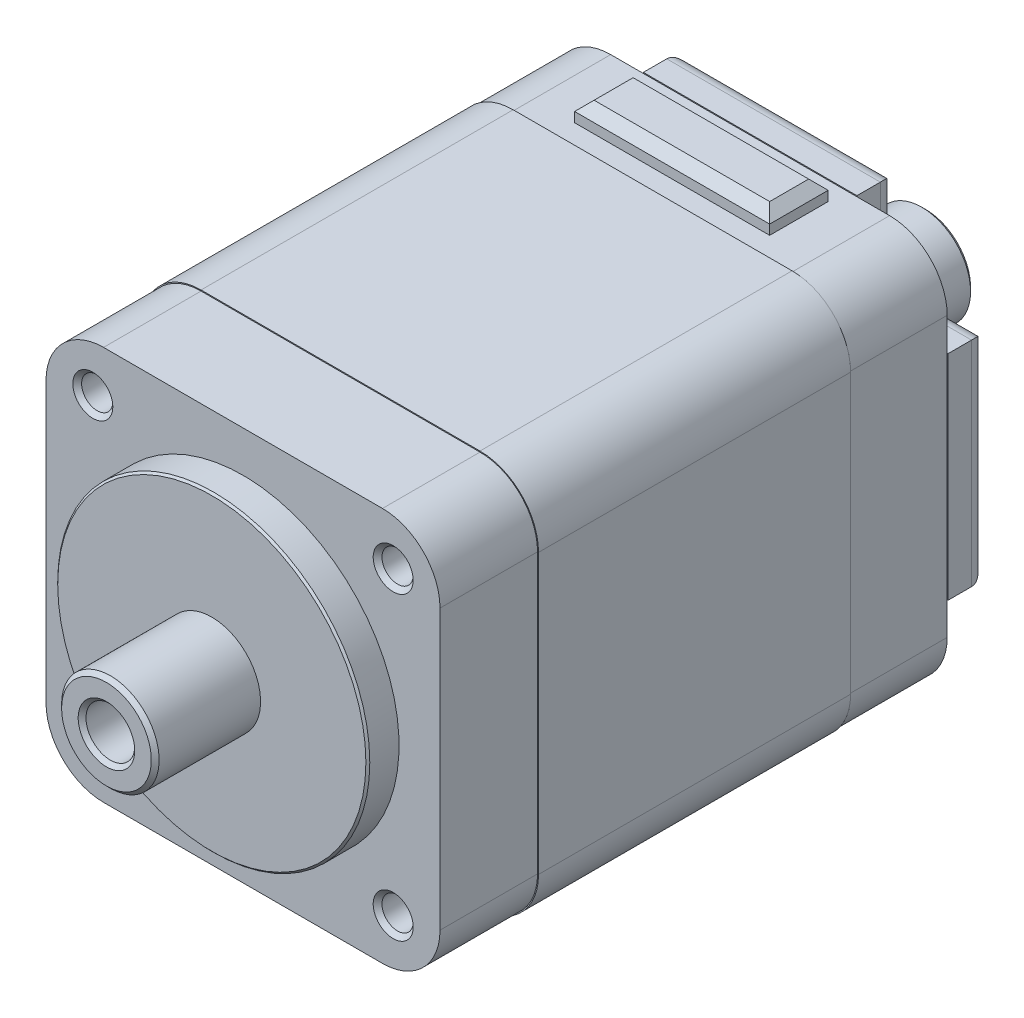
from build123d import *

# Parameters (mm, degrees)
SKETCH1_W               = 26
SKETCH1_H               = 20.3
BOSS_EXTRUDE1_DEPTH     = 10.15
SKETCH2_R               = 8
BOSS_EXTRUDE2_DEPTH     = 1.6
SKETCH3_R               = 2.5
BOSS_EXTRUDE3_DEPTH     = 5.4
CUT_EXTRUDE1_DEPTH      = 36.986733667
CUT_EXTRUDE1_DEPTH_BACK = 36.986733667
SKETCH4_R               = 1.25
CHAMFER1_SIZE           = 0.2
CHAMFER2_SIZE           = 0.2
SKETCH6_R               = 2.5
SKETCH6_R_2             = 1.25
BOSS_EXTRUDE4_DEPTH     = 9
SKETCH7_R               = 0.5
CUT_EXTRUDE2_DEPTH      = 2
CUT_EXTRUDE3_START      = -2
SKETCH8_R               = 0.5
CUT_EXTRUDE3_DEPTH      = 2
FILLET1_R               = 3
SKETCH10_R              = 2.6
BOSS_EXTRUDE5_DEPTH     = 2
FILLET2_R               = 0.8
SKETCH13_W              = 10
SKETCH13_H              = 3
BOSS_EXTRUDE7_DEPTH     = 1
CHAMFER3_SIZE           = 0.5
CUT_EXTRUDE5_DEPTH      = 5
CUT_EXTRUDE6_START      = -5
CUT_EXTRUDE6_DEPTH      = 5
CHAMFER4_SIZE           = 0.2
CHAMFER5_SIZE           = 0.1


# Read off the part's stored shape, not the designer's step: M2 Tapped Hole1
with BuildPart() as part:
    # Sketch1 → Boss-Extrude1 (new, symmetric)
    with BuildSketch(Plane(origin=(0, 0, 0), x_dir=(0, 0, -1), z_dir=(1, 0, 0))):
        Rectangle(SKETCH1_W, SKETCH1_H)
    extrude(amount=BOSS_EXTRUDE1_DEPTH, both=True)

    # Sketch2 → Boss-Extrude2 (add)
    with BuildSketch(Plane.XY.offset(13)):
        with Locations(Location((0, 0, 0), (0, 0, 180))):
            Circle(SKETCH2_R)
    extrude(amount=BOSS_EXTRUDE2_DEPTH)

    # Sketch3 → Boss-Extrude3 (add)
    with BuildSketch(Plane.XY.offset(14.6)):
        with Locations(Location((0, 0, 0), (0, 0, 180))):
            Circle(SKETCH3_R)
    extrude(amount=BOSS_EXTRUDE3_DEPTH)

    # Sketch4 → Cut-Extrude1 (cut, two sides: drawn at the far end of the back side and taken through both)
    with BuildSketch(Plane.XY.offset(20).offset(-CUT_EXTRUDE1_DEPTH_BACK)):
        Circle(SKETCH4_R)
    extrude(amount=CUT_EXTRUDE1_DEPTH + CUT_EXTRUDE1_DEPTH_BACK, mode=Mode.SUBTRACT)

    # Chamfer1
    chamfer1_edges = [part.edges().sort_by_distance(p)[0] for p in [
        (-1.25, 0, 20),
    ]]
    chamfer(chamfer1_edges, length=CHAMFER1_SIZE)

    # Chamfer2
    chamfer2_edges = [part.edges().sort_by_distance(p)[0] for p in [
        (2.5, 0, 20),
    ]]
    chamfer(chamfer2_edges, length=CHAMFER2_SIZE)

    # Sketch6 → Boss-Extrude4 (add)
    with BuildSketch(Plane(origin=(0, 0, -13), x_dir=(-1, 0, 0), z_dir=(0, 0, -1))):
        Circle(SKETCH6_R)
        with Locations(Location((0, 0, 0), (0, 0, 180))):
            Circle(SKETCH6_R_2, mode=Mode.SUBTRACT)
    extrude(amount=BOSS_EXTRUDE4_DEPTH)

    # Sketch7 → Cut-Extrude2 (cut)
    with BuildSketch(Plane.XY.offset(13)):
        with Locations((-7.7, 7.7)):
            Circle(SKETCH7_R)
        with Locations((7.7, 7.7)):
            Circle(SKETCH7_R)
        with Locations((7.7, -7.7)):
            Circle(SKETCH7_R)
        with Locations((-7.7, -7.7)):
            Circle(SKETCH7_R)
    extrude(amount=-CUT_EXTRUDE2_DEPTH, mode=Mode.SUBTRACT)

    # Sketch8 → Cut-Extrude3 (cut)
    with BuildSketch(Plane(origin=(0, 0, -13), x_dir=(-1, 0, 0), z_dir=(0, 0, -1)).offset(CUT_EXTRUDE3_START)):
        with Locations(Location((7.7, -7.7, 0), (0, 0, 180))):
            Circle(SKETCH8_R)
        with Locations(Location((-7.7, -7.7, 0), (0, 0, 180))):
            Circle(SKETCH8_R)
        with Locations(Location((-7.7, 7.7, 0), (0, 0, 180))):
            Circle(SKETCH8_R)
        with Locations(Location((7.7, 7.7, 0), (0, 0, 180))):
            Circle(SKETCH8_R)
    extrude(amount=CUT_EXTRUDE3_DEPTH, mode=Mode.SUBTRACT)

    # M2 Tapped Hole1 outline → M2 Tapped Hole1 (revolve, cut)
    with BuildSketch(Plane(origin=(-7.7, 7.7, 0), x_dir=(1, 0, 0), z_dir=(0, -1, 0))):
        Polygon((0, -9.519311505), (0, -11), (0.5, -11), (0.5, -13), (1.025, -13), (0.8, -12.775), (0.8, -10), align=None)
        Polygon((0, 11), (0, 9.519311505), (0.8, 10), (0.8, 12.775), (1.025, 13), (0.5, 13), (0.5, 11), align=None)
    revolve(axis=Axis((-7.7, 7.7, 0), (0, 0, 1)), mode=Mode.SUBTRACT)

    # M2 Tapped Hole1 2 outline → M2 Tapped Hole1 2 (revolve, cut)
    with BuildSketch(Plane(origin=(7.7, -7.7, 0), x_dir=(1, 0, 0), z_dir=(0, -1, 0))):
        Polygon((0, -9.519311505), (0, -11), (0.5, -11), (0.5, -13), (1.025, -13), (0.8, -12.775), (0.8, -10), align=None)
        Polygon((0, 11), (0, 9.519311505), (0.8, 10), (0.8, 12.775), (1.025, 13), (0.5, 13), (0.5, 11), align=None)
    revolve(axis=Axis((7.7, -7.7, 0), (0, 0, 1)), mode=Mode.SUBTRACT)

    # M2 Tapped Hole1 3 outline → M2 Tapped Hole1 3 (revolve, cut)
    with BuildSketch(Plane(origin=(7.7, 7.7, 0), x_dir=(1, 0, 0), z_dir=(0, -1, 0))):
        Polygon((0, -9.519311505), (0, -11), (0.5, -11), (0.5, -13), (1.025, -13), (0.8, -12.775), (0.8, -10), align=None)
        Polygon((0, 11), (0, 9.519311505), (0.8, 10), (0.8, 12.775), (1.025, 13), (0.5, 13), (0.5, 11), align=None)
    revolve(axis=Axis((7.7, 7.7, 0), (0, 0, 1)), mode=Mode.SUBTRACT)

    # M2 Tapped Hole1 4 outline → M2 Tapped Hole1 4 (revolve, cut)
    with BuildSketch(Plane(origin=(-7.7, -7.7, 0), x_dir=(1, 0, 0), z_dir=(0, -1, 0))):
        Polygon((0, -9.519311505), (0, -11), (0.5, -11), (0.5, -13), (1.025, -13), (0.8, -12.775), (0.8, -10), align=None)
        Polygon((0, 11), (0, 9.519311505), (0.8, 10), (0.8, 12.775), (1.025, 13), (0.5, 13), (0.5, 11), align=None)
    revolve(axis=Axis((-7.7, -7.7, 0), (0, 0, 1)), mode=Mode.SUBTRACT)

    # Fillet1
    fillet1_edges = [part.edges().sort_by_distance(p)[0] for p in [
        (10.15, -10.15, 0),
        (-10.15, -10.15, 0),
        (-10.15, 10.15, 0),
        (10.15, 10.15, 0),
    ]]
    fillet(fillet1_edges, radius=FILLET1_R)

    # Sketch13 → Boss-Extrude7 (add)
    with BuildSketch(Plane(origin=(0, 10.15, 0), x_dir=(1, 0, 0), z_dir=(0, 1, 0))):
        with Locations((0, 10.5)):
            Rectangle(SKETCH13_W, SKETCH13_H)
    extrude(amount=BOSS_EXTRUDE7_DEPTH)

    # Chamfer3
    chamfer3_edges = [part.edges().sort_by_distance(p)[0] for p in [
        (-5, 11.15, -10.5),
        (0, 11.15, -9),
        (5, 11.15, -10.5),
        (0, 11.15, -12),
    ]]
    chamfer(chamfer3_edges, length=CHAMFER3_SIZE)

    # Sketch14 → Cut-Extrude5 (cut)
    with BuildSketch(Plane.XY.offset(13)):
        with BuildLine():
            Line((10.15, -7.15), (10.15, 7.15))
            ThreePointArc((10.15, 7.15), (9.271320344, 9.271320344), (7.15, 10.15))
            Line((7.15, 10.15), (-7.15, 10.15))
            ThreePointArc((-7.15, 10.15), (-9.271320344, 9.271320344), (-10.15, 7.15))
            Line((-10.15, 7.15), (-10.15, -7.15))
            ThreePointArc((-10.15, -7.15), (-9.271320344, -9.271320344), (-7.15, -10.15))
            Line((-7.15, -10.15), (7.15, -10.15))
            ThreePointArc((7.15, -10.15), (9.271320344, -9.271320344), (10.15, -7.15))
        make_face()
        with BuildLine():
            Line((10.1, -7.15), (10.1, 7.15))
            ThreePointArc((10.1, 7.15), (9.235965005, 9.235965005), (7.15, 10.1))
            Line((7.15, 10.1), (-7.15, 10.1))
            ThreePointArc((-7.15, 10.1), (-9.235965005, 9.235965005), (-10.1, 7.15))
            Line((-10.1, 7.15), (-10.1, -7.15))
            ThreePointArc((-10.1, -7.15), (-9.235965005, -9.235965005), (-7.15, -10.1))
            Line((-7.15, -10.1), (7.15, -10.1))
            ThreePointArc((7.15, -10.1), (9.235965005, -9.235965005), (10.1, -7.15))
        make_face(mode=Mode.SUBTRACT)
    extrude(amount=-CUT_EXTRUDE5_DEPTH, mode=Mode.SUBTRACT)

    # Sketch15 → Cut-Extrude6 (cut)
    with BuildSketch(Plane(origin=(0, 0, -13), x_dir=(-1, 0, 0), z_dir=(0, 0, -1)).offset(CUT_EXTRUDE6_START)):
        with BuildLine():
            Line((7.15, 10.15), (-7.15, 10.15))
            ThreePointArc((-7.15, 10.15), (-9.271320344, 9.271320344), (-10.15, 7.15))
            Line((-10.15, 7.15), (-10.15, -7.15))
            ThreePointArc((-10.15, -7.15), (-9.271320344, -9.271320344), (-7.15, -10.15))
            Line((-7.15, -10.15), (7.15, -10.15))
            ThreePointArc((7.15, -10.15), (9.271320344, -9.271320344), (10.15, -7.15))
            Line((10.15, -7.15), (10.15, 7.15))
            ThreePointArc((10.15, 7.15), (9.271320344, 9.271320344), (7.15, 10.15))
        make_face()
        with BuildLine():
            Line((-10.1, 7.15), (-10.1, -7.15))
            ThreePointArc((-10.1, -7.15), (-9.235965005, -9.235965005), (-7.15, -10.1))
            Line((-7.15, -10.1), (7.15, -10.1))
            ThreePointArc((7.15, -10.1), (9.235965005, -9.235965005), (10.1, -7.15))
            Line((10.1, -7.15), (10.1, 7.15))
            ThreePointArc((10.1, 7.15), (9.235965005, 9.235965005), (7.15, 10.1))
            Line((7.15, 10.1), (-7.15, 10.1))
            ThreePointArc((-7.15, 10.1), (-9.235965005, 9.235965005), (-10.1, 7.15))
        make_face(mode=Mode.SUBTRACT)
    extrude(amount=CUT_EXTRUDE6_DEPTH, mode=Mode.SUBTRACT)


with BuildPart() as body_2:
    # Sketch10 → Boss-Extrude5 (new body)
    with BuildSketch(Plane(origin=(0, 0, -13), x_dir=(-1, 0, 0), z_dir=(0, 0, -1))):
        with BuildLine():
            ThreePointArc((-5.475, 7.7), (-6.126687412, 6.126687412), (-7.7, 5.475))
            Line((-7.7, 5.475), (-10.15, 5.475))
            Line((-10.15, 5.475), (-10.15, -5.475))
            Line((-10.15, -5.475), (-7.7, -5.475))
            ThreePointArc((-7.7, -5.475), (-6.126687412, -6.126687412), (-5.475, -7.7))
            Line((-5.475, -7.7), (-5.475, -10.15))
            Line((-5.475, -10.15), (5.475, -10.15))
            Line((5.475, -10.15), (5.475, -7.7))
            ThreePointArc((5.475, -7.7), (6.126687412, -6.126687412), (7.7, -5.475))
            Line((7.7, -5.475), (10.15, -5.475))
            Line((10.15, -5.475), (10.15, 5.475))
            Line((10.15, 5.475), (7.7, 5.475))
            ThreePointArc((7.7, 5.475), (6.126687412, 6.126687412), (5.475, 7.7))
            Line((5.475, 7.7), (5.475, 10.15))
            Line((5.475, 10.15), (-5.475, 10.15))
            Line((-5.475, 10.15), (-5.475, 7.7))
        make_face()
        Circle(SKETCH10_R, mode=Mode.SUBTRACT)
    extrude(amount=BOSS_EXTRUDE5_DEPTH)

    # Fillet2
    fillet2_edges = [body_2.edges().sort_by_distance(p)[0] for p in [
        (-6.126687412, -6.126687412, -15),
        (-8.925, -5.475, -15),
        (-10.15, 0, -15),
        (-8.925, 5.475, -15),
        (-6.126687412, 6.126687412, -15),
        (-5.475, 8.925, -15),
        (0, 10.15, -15),
        (5.475, 8.925, -15),
        (6.126687412, 6.126687412, -15),
        (8.925, 5.475, -15),
        (10.15, 0, -15),
        (8.925, -5.475, -15),
        (6.126687412, -6.126687412, -15),
        (5.475, -8.925, -15),
        (0, -10.15, -15),
        (-5.475, -8.925, -15),
    ]]
    fillet(fillet2_edges, radius=FILLET2_R)


with BuildPart() as cut_extrude6_piece_1:
    # of the separate pieces the step leaves, piece 1, a body of its own (cut_extrude6_pieces)
    add(part.part.solids().sort_by_distance((-7.15, 10.15, -8))[0])

    # Chamfer4
    chamfer4_edges = [cut_extrude6_piece_1.edges().sort_by_distance(p)[0] for p in [
        (-1.25, 0, -22),
        (2.5, 0, -22),
    ]]
    chamfer(chamfer4_edges, length=CHAMFER4_SIZE)

    # Chamfer5
    chamfer5_edges = [cut_extrude6_piece_1.edges().sort_by_distance(p)[0] for p in [
        (8, 0, 14.6),
    ]]
    chamfer(chamfer5_edges, length=CHAMFER5_SIZE)


with BuildPart() as cut_extrude6_piece_2:
    # of the separate pieces the step leaves, piece 2, a body of its own (cut_extrude6_pieces)
    add(part.part.solids().sort_by_distance((5, 10.65, -12))[0])


solid = Compound([body_2.part, cut_extrude6_piece_1.part, cut_extrude6_piece_2.part])
